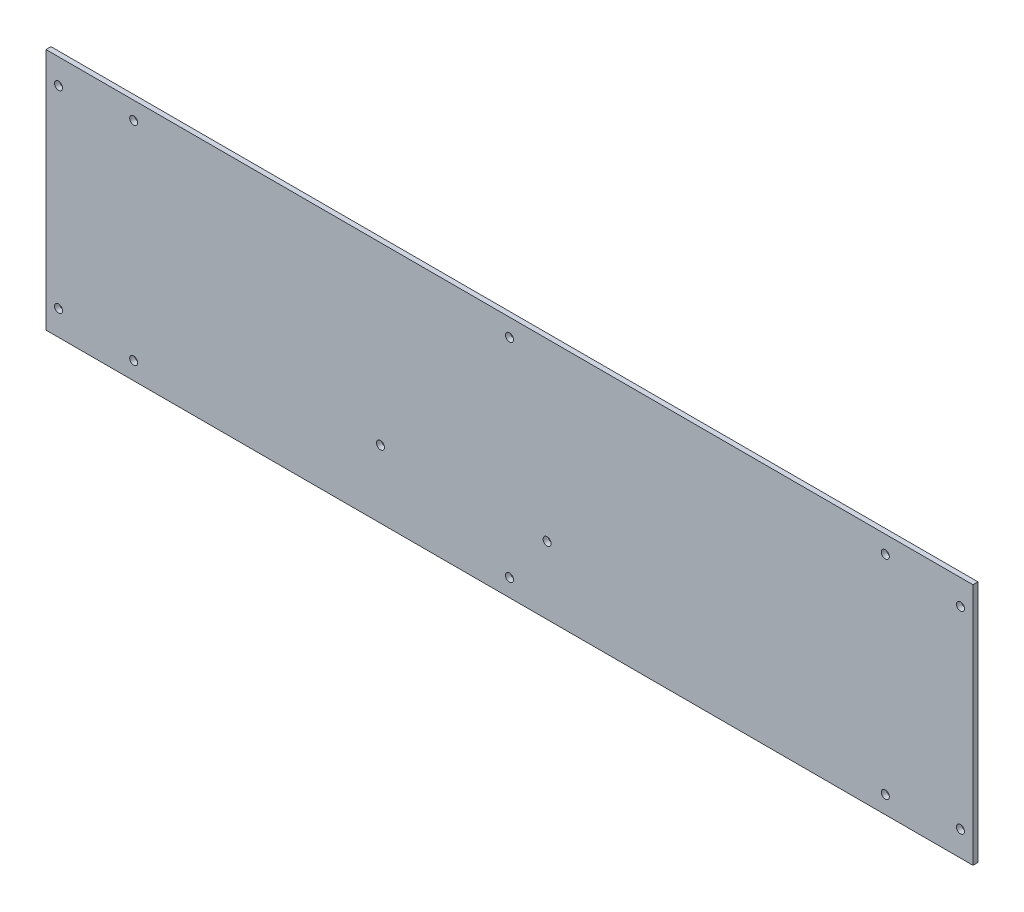
from build123d import *

# Parameters (mm, degrees)
SKETCH1_W          = 97
SKETCH1_H          = 370
SKETCH1_R          = 1.6
BASE_FLANGE1_DEPTH = 2


# Sheet-metal steps are written as plain solids
with BuildPart() as part:
    # Sketch1 → Base-Flange1 (new body)
    with BuildSketch(Plane(origin=(0, 0, 0), x_dir=(0, 1, 0), z_dir=(0, 0, 1))):
        with Locations((48.5, 185)):
            Rectangle(SKETCH1_W, SKETCH1_H)
        with Locations(Location((10, 5, 0), (0, 0, 270))):
            Circle(SKETCH1_R, mode=Mode.SUBTRACT)
        with Locations(Location((87, 5, 0), (0, 0, 270))):
            Circle(SKETCH1_R, mode=Mode.SUBTRACT)
        with Locations(Location((10, 365, 0), (0, 0, 270))):
            Circle(SKETCH1_R, mode=Mode.SUBTRACT)
        with Locations(Location((87, 365, 0), (0, 0, 270))):
            Circle(SKETCH1_R, mode=Mode.SUBTRACT)
        with Locations(Location((90, 185, 0), (0, 0, 270))):
            Circle(SKETCH1_R, mode=Mode.SUBTRACT)
        with Locations(Location((90, 35, 0), (0, 0, 270))):
            Circle(SKETCH1_R, mode=Mode.SUBTRACT)
        with Locations(Location((90, 335, 0), (0, 0, 270))):
            Circle(SKETCH1_R, mode=Mode.SUBTRACT)
        with Locations(Location((27, 236.5, 0), (0, 0, 270))):
            Circle(SKETCH1_R, mode=Mode.SUBTRACT)
        with Locations(Location((27, 170, 0), (0, 0, 270))):
            Circle(SKETCH1_R, mode=Mode.SUBTRACT)
        with Locations(Location((7, 185, 0), (0, 0, 270))):
            Circle(SKETCH1_R, mode=Mode.SUBTRACT)
        with Locations(Location((7, 335, 0), (0, 0, 270))):
            Circle(SKETCH1_R, mode=Mode.SUBTRACT)
        with Locations(Location((7, 35, 0), (0, 0, 270))):
            Circle(SKETCH1_R, mode=Mode.SUBTRACT)
    extrude(amount=-BASE_FLANGE1_DEPTH)


solid = part.part
